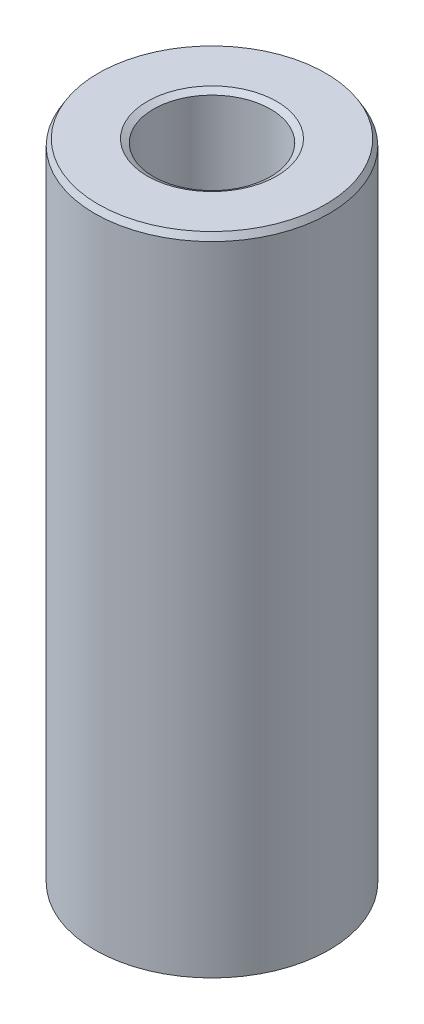
from build123d import *
from OCP.BRepFilletAPI import BRepFilletAPI_MakeChamfer

# Parameters (mm, degrees)
SKETCH1_R           = 22.5
BOSS_EXTRUDE1_DEPTH = 124.259235383
SKETCH2_R           = 11.234346515
CUT_EXTRUDE1_DEPTH  = 129.268692899
CHAMFER1_SIZE       = 1.187464537
CHAMFER1_SIZE2      = 0.68558297


with BuildPart() as part:
    # Sketch1 → Boss-Extrude1 (new body)
    with BuildSketch(Plane(origin=(0, 0, 0), x_dir=(1, 0, 0), z_dir=(0, 1, 0))):
        Circle(SKETCH1_R)
    extrude(amount=BOSS_EXTRUDE1_DEPTH)

    # Sketch2 → Cut-Extrude1 (cut, through all)
    with BuildSketch(Plane(origin=(0, 0, 0), x_dir=(1, 0, 0), z_dir=(0, 1, 0))):
        Circle(SKETCH2_R)
    extrude(amount=CUT_EXTRUDE1_DEPTH, mode=Mode.SUBTRACT)

    # Chamfer1: one chamfer whose edges measure the first distance from different faces: ONE call of the kernel's chamfer builder (chamfer() names one face for all edges)
    chamfer1_edges_1 = [part.edges().sort_by_distance(p)[0] for p in [
        (-11.234346515, 124.259235383, 0),
    ]]
    chamfer1_side_1 = [part.faces().sort_by_distance(p)[0] for p in [
        (-21.863603897, 124.259235383, 0),
    ]]
    chamfer1_edges_2 = [part.edges().sort_by_distance(p)[0] for p in [
        (-11.234346515, 0, 0),
    ]]
    chamfer1_side_2 = [part.faces().sort_by_distance(p)[0] for p in [
        (-11.234346515, 62.129617692, 0),
    ]]
    chamfer1_edges_3 = [part.edges().sort_by_distance(p)[0] for p in [
        (-22.5, 0, 0),
    ]]
    chamfer1_side_3 = [part.faces().sort_by_distance(p)[0] for p in [
        (-21.863603897, 0, 0),
    ]]
    chamfer1_edges_4 = [part.edges().sort_by_distance(p)[0] for p in [
        (-22.5, 124.259235383, 0),
    ]]
    chamfer1_side_4 = [part.faces().sort_by_distance(p)[0] for p in [
        (-22.5, 62.129617692, 0),
    ]]
    chamfer1 = BRepFilletAPI_MakeChamfer(part.part.solid().wrapped)
    for e in chamfer1_edges_1:
        chamfer1.Add(CHAMFER1_SIZE, CHAMFER1_SIZE2, e.wrapped, chamfer1_side_1[0].wrapped)  # the first distance lies on this face
    for e in chamfer1_edges_2:
        chamfer1.Add(CHAMFER1_SIZE, CHAMFER1_SIZE2, e.wrapped, chamfer1_side_2[0].wrapped)  # the first distance lies on this face
    for e in chamfer1_edges_3:
        chamfer1.Add(CHAMFER1_SIZE, CHAMFER1_SIZE2, e.wrapped, chamfer1_side_3[0].wrapped)  # the first distance lies on this face
    for e in chamfer1_edges_4:
        chamfer1.Add(CHAMFER1_SIZE, CHAMFER1_SIZE2, e.wrapped, chamfer1_side_4[0].wrapped)  # the first distance lies on this face
    add(Compound.cast(chamfer1.Shape()), mode=Mode.REPLACE)


solid = part.part
